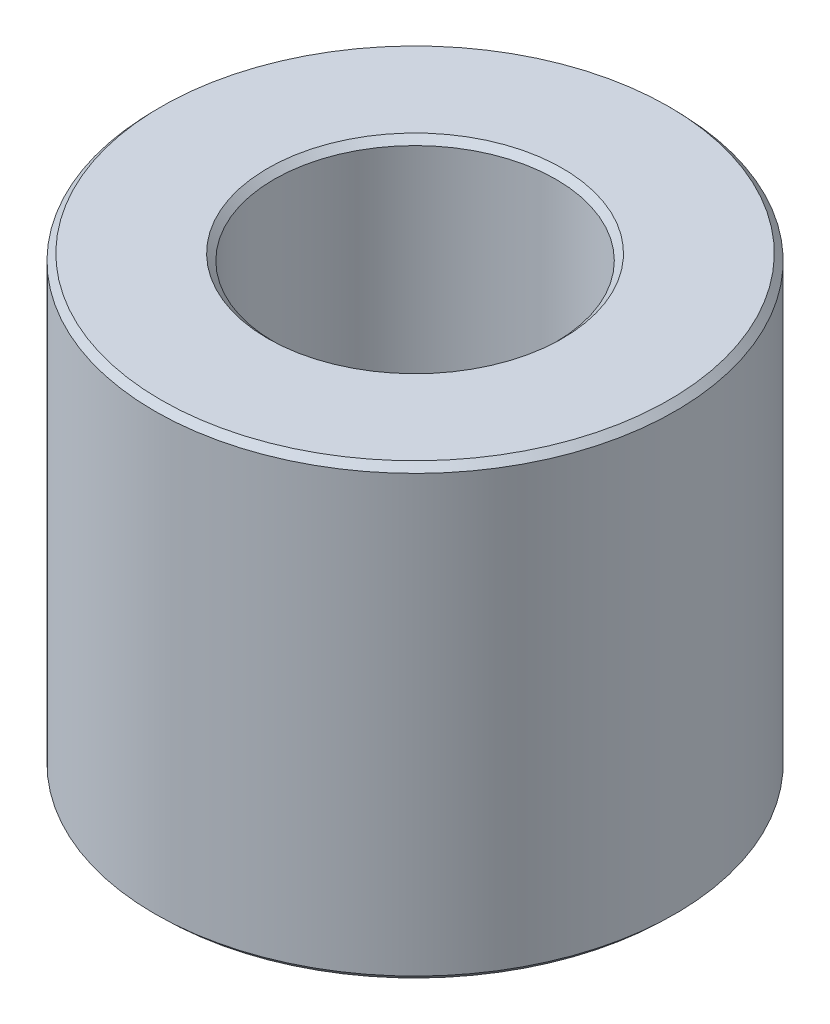
from build123d import *
from OCP.BRepFilletAPI import BRepFilletAPI_MakeChamfer

# Parameters (mm, degrees)
SKETCH1_R           = 45
BOSS_EXTRUDE1_DEPTH = 77.478887143
SKETCH2_R           = 24.360294216
CUT_EXTRUDE1_DEPTH  = 101.264539858
CHAMFER1_SIZE       = 1.126974265
CHAMFER1_SIZE2      = 1.083152909


with BuildPart() as part:
    # Sketch1 → Boss-Extrude1 (new body)
    with BuildSketch(Plane(origin=(0, 0, 0), x_dir=(1, 0, 0), z_dir=(0, 1, 0))):
        Circle(SKETCH1_R)
    extrude(amount=BOSS_EXTRUDE1_DEPTH)

    # Sketch2 → Cut-Extrude1 (cut, through all)
    with BuildSketch(Plane(origin=(0, 0, 0), x_dir=(1, 0, 0), z_dir=(0, 1, 0))):
        Circle(SKETCH2_R)
    extrude(amount=CUT_EXTRUDE1_DEPTH, mode=Mode.SUBTRACT)

    # Chamfer1: one chamfer whose edges measure the first distance from different faces: ONE call of the kernel's chamfer builder (chamfer() names one face for all edges)
    chamfer1_edges_1 = [part.edges().sort_by_distance(p)[0] for p in [
        (-24.360294216, 77.478887143, 0),
    ]]
    chamfer1_side_1 = [part.faces().sort_by_distance(p)[0] for p in [
        (-43.727207794, 77.478887143, 0),
    ]]
    chamfer1_edges_2 = [part.edges().sort_by_distance(p)[0] for p in [
        (-24.360294216, 0, 0),
    ]]
    chamfer1_side_2 = [part.faces().sort_by_distance(p)[0] for p in [
        (-24.360294216, 38.739443572, 0),
    ]]
    chamfer1_edges_3 = [part.edges().sort_by_distance(p)[0] for p in [
        (-45, 0, 0),
    ]]
    chamfer1_side_3 = [part.faces().sort_by_distance(p)[0] for p in [
        (-43.727207794, 0, 0),
    ]]
    chamfer1_edges_4 = [part.edges().sort_by_distance(p)[0] for p in [
        (-45, 77.478887143, 0),
    ]]
    chamfer1_side_4 = [part.faces().sort_by_distance(p)[0] for p in [
        (-45, 38.739443572, 0),
    ]]
    chamfer1 = BRepFilletAPI_MakeChamfer(part.part.solid().wrapped)
    for e in chamfer1_edges_1:
        chamfer1.Add(CHAMFER1_SIZE, CHAMFER1_SIZE2, e.wrapped, chamfer1_side_1[0].wrapped)  # the first distance lies on this face
    for e in chamfer1_edges_2:
        chamfer1.Add(CHAMFER1_SIZE, CHAMFER1_SIZE2, e.wrapped, chamfer1_side_2[0].wrapped)  # the first distance lies on this face
    for e in chamfer1_edges_3:
        chamfer1.Add(CHAMFER1_SIZE, CHAMFER1_SIZE2, e.wrapped, chamfer1_side_3[0].wrapped)  # the first distance lies on this face
    for e in chamfer1_edges_4:
        chamfer1.Add(CHAMFER1_SIZE, CHAMFER1_SIZE2, e.wrapped, chamfer1_side_4[0].wrapped)  # the first distance lies on this face
    add(Compound.cast(chamfer1.Shape()), mode=Mode.REPLACE)


solid = part.part
